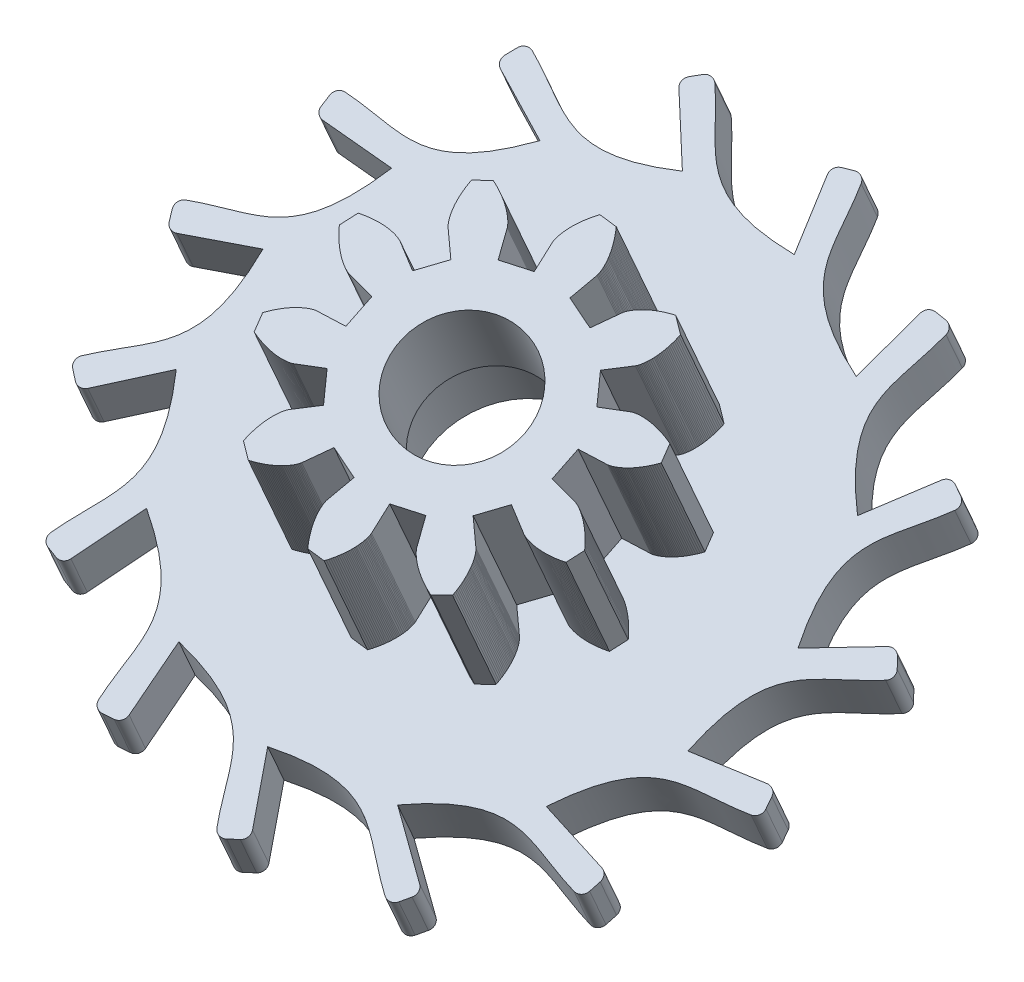
from build123d import *

# Parameters (mm, degrees)
BOSS_EXTRU_1_DEPTH                                = 3
BOSS_EXTRU_2_DEPTH                                = 8
CHAMBRAGE_POUR_VIS_T_TE_COURTE_BOMB_E_D           = 6
CHAMBRAGE_POUR_VIS_T_TE_COURTE_BOMB_E_DEPTH       = 23.010610864
CHAMBRAGE_POUR_VIS_T_TE_COURTE_BOMB_E_CBORE_D     = 8.2
CHAMBRAGE_POUR_VIS_T_TE_COURTE_BOMB_E_CBORE_DEPTH = 6
CHANFREIN1_SIZE                                   = 0.5
CONG_1_R                                          = 0.4


with BuildPart() as part:
    # Esquisse1 → Boss.-Extru.1 (new body)
    with BuildSketch(Plane(origin=(6.407585618, 24.446842904, 14.355449102), x_dir=(-0.9673252584845773, 0.2535386445845004, 0), z_dir=(0.22045579862678263, 0.8411043718426235, 0.49390553400326775))):
        with BuildLine():
            Line((11.803950496, -29.629611173), (11.728763686, -30.913090095))
            Line((11.728763686, -30.913090095), (15.322288109, -31.288362296))
            add(Edge.make_bspline(
                [(15.322288109, -31.288362296), (13.693575324, -35.735251177), (11.898416098, -34.95334924), (9.092736439, -36.069585831)],
                knots=[0, 0, 0, 0, 1, 1, 1, 1], degree=3))
            Line((9.092736439, -36.069585831), (9.546087778, -37.272683401))
            Line((9.546087778, -37.272683401), (12.981572647, -36.153893555))
            add(Edge.make_bspline(
                [(12.981572647, -36.153893555), (13.302382135, -40.878785864), (11.34439441, -40.894639938), (9.235292826, -43.055545531)],
                knots=[0, 0, 0, 0, 1, 1, 1, 1], degree=3))
            Line((9.235292826, -43.055545531), (10.138793749, -43.970235249))
            Line((10.138793749, -43.970235249), (12.822212519, -41.550832285))
            add(Edge.make_bspline(
                [(12.822212519, -41.550832285), (15.037073407, -45.736751217), (13.254811047, -46.547619989), (12.206970362, -49.379554377)],
                knots=[0, 0, 0, 0, 1, 1, 1, 1], degree=3))
            Line((12.206970362, -49.379554377), (13.404397352, -49.847678081))
            Line((13.404397352, -49.847678081), (14.871762541, -46.54599875))
            add(Edge.make_bspline(
                [(14.871762541, -46.54599875), (18.597705259, -49.469160894), (17.299337618, -50.934837787), (17.493939006, -53.948133786)],
                knots=[0, 0, 0, 0, 1, 1, 1, 1], degree=3))
            Line((17.493939006, -53.948133786), (18.778246057, -53.888748635))
            Line((18.778246057, -53.888748635), (18.775836893, -50.275683289))
            add(Edge.make_bspline(
                [(18.775836893, -50.275683289), (23.368612096, -51.430647354), (22.778638734, -53.297703518), (24.182033848, -55.971334874)],
                knots=[0, 0, 0, 0, 1, 1, 1, 1], degree=3))
            Line((24.182033848, -55.971334874), (25.331152604, -55.394709101))
            Line((25.331152604, -55.394709101), (23.859385652, -52.094989561))
            add(Edge.make_bspline(
                [(23.859385652, -52.094989561), (28.524860784, -51.282051768), (28.745293456, -53.22765623), (31.11482253, -55.099327794)],
                knots=[0, 0, 0, 0, 1, 1, 1, 1], degree=3))
            Line((31.11482253, -55.099327794), (31.930059919, -54.105165233))
            Line((31.930059919, -54.105165233), (29.243417056, -51.689342985))
            add(Edge.make_bspline(
                [(29.243417056, -51.689342985), (33.174889081, -49.049067664), (34.167612976, -50.736807738), (37.093562907, -51.482890492)],
                knots=[0, 0, 0, 0, 1, 1, 1, 1], degree=3))
            Line((37.093562907, -51.482890492), (37.433956978, -50.243090881))
            Line((37.433956978, -50.243090881), (33.996983163, -49.128883539))
            add(Edge.make_bspline(
                [(33.996983163, -49.128883539), (36.514664852, -45.117798278), (38.108028988, -46.255848372), (41.084476452, -45.74733783)],
                knots=[0, 0, 0, 0, 1, 1, 1, 1], degree=3))
            Line((41.084476452, -45.74733783), (40.891169978, -44.476273786))
            Line((40.891169978, -44.476273786), (37.298149207, -44.856337922))
            add(Edge.make_bspline(
                [(37.298149207, -44.856337922), (37.966710524, -40.167995803), (39.885207768, -40.559576717), (42.397497958, -38.884398971)],
                knots=[0, 0, 0, 0, 1, 1, 1, 1], degree=3))
            Line((42.397497958, -38.884398971), (41.703915383, -37.801849014))
            Line((41.703915383, -37.801849014), (38.57611359, -39.610468085))
            add(Edge.make_bspline(
                [(38.57611359, -39.610468085), (37.279954209, -35.055526053), (39.191858958, -34.632929889), (40.805594077, -32.080738391)],
                knots=[0, 0, 0, 0, 1, 1, 1, 1], degree=3))
            Line((40.805594077, -32.080738391), (39.731662131, -31.373885243))
            Line((39.731662131, -31.373885243), (37.609904659, -34.298332582))
            add(Edge.make_bspline(
                [(37.609904659, -34.298332582), (34.573142313, -30.664381493), (36.147868867, -29.500678968), (36.584019452, -26.512770813)],
                knots=[0, 0, 0, 0, 1, 1, 1, 1], degree=3))
            Line((36.584019452, -26.512770813), (35.315430724, -26.303835805))
            Line((35.315430724, -26.303835805), (34.566588718, -29.838447899))
            add(Edge.make_bspline(
                [(34.566588718, -29.838447899), (30.314307204, -27.753830912), (31.279571035, -26.050236763), (30.462722688, -23.143248416)],
                knots=[0, 0, 0, 0, 1, 1, 1, 1], degree=3))
            Line((30.462722688, -23.143248416), (29.218827694, -23.468358308))
            Line((29.218827694, -23.468358308), (29.972382739, -27.001968615))
            add(Edge.make_bspline(
                [(29.972382739, -27.001968615), (25.239840161, -26.827134944), (25.428738385, -24.878216078), (23.500131606, -22.554792232)],
                knots=[0, 0, 0, 0, 1, 1, 1, 1], degree=3))
            Line((23.500131606, -22.554792232), (22.496011091, -23.357732572))
            Line((22.496011091, -23.357732572), (24.621666673, -26.279347767))
            add(Edge.make_bspline(
                [(24.621666673, -26.279347767), (20.227162638, -28.044527742), (19.607033035, -26.187269935), (16.900141457, -24.849151682)],
                knots=[0, 0, 0, 0, 1, 1, 1, 1], degree=3))
            Line((16.900141457, -24.849151682), (16.30941698, -25.99108679))
            Line((16.30941698, -25.99108679), (19.439627938, -27.795533065))
            add(Edge.make_bspline(
                [(19.439627938, -27.795533065), (16.143012116, -31.195511032), (14.821080728, -29.751051032), (11.803950496, -29.629611173)],
                knots=[0, 0, 0, 0, 1, 1, 1, 1], degree=3))
        make_face()
    extrude(amount=-BOSS_EXTRU_1_DEPTH)

    # Esquisse2 → Boss.-Extru.2 (add)
    with BuildSketch(Plane(origin=(6.407585618, 24.446842904, 14.355449102), x_dir=(-0.9753969657794858, 0.19010345790327643, 0.11163079521973293), z_dir=(0.2204557986267831, 0.8411043718426222, 0.49390553400326986))):
        with BuildLine():
            Line((25.270754298, -43.143163892), (26.515512888, -43.38453265))
            Line((26.515512888, -43.38453265), (26.567222661, -43.399334931))
            Line((26.567222661, -43.399334931), (26.61574384, -43.417050188))
            Line((26.61574384, -43.417050188), (26.667564853, -43.438800124))
            Line((26.667564853, -43.438800124), (26.716116779, -43.461437811))
            Line((26.716116779, -43.461437811), (26.770669603, -43.489227805))
            Line((26.770669603, -43.489227805), (26.815337874, -43.513717716))
            Line((26.815337874, -43.513717716), (26.863069243, -43.541535517))
            Line((26.863069243, -43.541535517), (26.913717572, -43.572856712))
            Line((26.913717572, -43.572856712), (26.967130705, -43.60785197))
            Line((26.967130705, -43.60785197), (27.023146535, -43.646685635))
            Line((27.023146535, -43.646685635), (27.081599033, -43.689516253))
            Line((27.081599033, -43.689516253), (27.142315555, -43.73649534))
            Line((27.142315555, -43.73649534), (27.183963754, -43.770193688))
            Line((27.183963754, -43.770193688), (27.226483313, -43.80584165))
            Line((27.226483313, -43.80584165), (27.269817307, -43.843480935))
            Line((27.269817307, -43.843480935), (27.313912265, -43.883151532))
            Line((27.313912265, -43.883151532), (27.358706456, -43.924889001))
            Line((27.358706456, -43.924889001), (27.404143227, -43.968730273))
            Line((27.404143227, -43.968730273), (27.450160749, -44.014710542))
            Line((27.450160749, -44.014710542), (27.49669962, -44.062862385))
            Line((27.49669962, -44.062862385), (27.543696586, -44.11321864))
            Line((27.543696586, -44.11321864), (27.591087007, -44.165807028))
            Line((27.591087007, -44.165807028), (27.638808794, -44.220658894))
            Line((27.638808794, -44.220658894), (27.68679774, -44.277800667))
            Line((27.68679774, -44.277800667), (27.734985294, -44.337257209))
            Line((27.734985294, -44.337257209), (27.783306653, -44.399052756))
            Line((27.783306653, -44.399052756), (27.831694962, -44.463209748))
            Line((27.831694962, -44.463209748), (27.880082238, -44.529749366))
            Line((27.880082238, -44.529749366), (27.928397947, -44.598689163))
            Line((27.928397947, -44.598689163), (27.976796649, -44.670388016))
            Line((27.976796649, -44.670388016), (27.6973601, -45.404869881))
            Line((27.6973601, -45.404869881), (27.613542912, -45.426265899))
            Line((27.613542912, -45.426265899), (27.531621211, -45.445656607))
            Line((27.531621211, -45.445656607), (27.451242646, -45.463206169))
            Line((27.451242646, -45.463206169), (27.372445969, -45.478975057))
            Line((27.372445969, -45.478975057), (27.295269197, -45.493023944))
            Line((27.295269197, -45.493023944), (27.219746697, -45.505414492))
            Line((27.219746697, -45.505414492), (27.145911806, -45.516207465))
            Line((27.145911806, -45.516207465), (27.073798025, -45.525467113))
            Line((27.073798025, -45.525467113), (27.003435336, -45.533256287))
            Line((27.003435336, -45.533256287), (26.934852458, -45.539638964))
            Line((26.934852458, -45.539638964), (26.868076748, -45.544679884))
            Line((26.868076748, -45.544679884), (26.803133737, -45.54844428))
            Line((26.803133737, -45.54844428), (26.740045272, -45.550996817))
            Line((26.740045272, -45.550996817), (26.678836184, -45.552404487))
            Line((26.678836184, -45.552404487), (26.619524302, -45.552733045))
            Line((26.619524302, -45.552733045), (26.562128945, -45.552049408))
            Line((26.562128945, -45.552049408), (26.506667411, -45.55042026))
            Line((26.506667411, -45.55042026), (26.453152976, -45.547913372))
            Line((26.453152976, -45.547913372), (26.376563223, -45.542653749))
            Line((26.376563223, -45.542653749), (26.304422566, -45.535799173))
            Line((26.304422566, -45.535799173), (26.236759679, -45.527578336))
            Line((26.236759679, -45.527578336), (26.173593609, -45.518220584))
            Line((26.173593609, -45.518220584), (26.11493431, -45.507954982))
            Line((26.11493431, -45.507954982), (26.060783299, -45.497011314))
            Line((26.060783299, -45.497011314), (26.011132873, -45.485617157))
            Line((26.011132873, -45.485617157), (25.951903535, -45.470117899))
            Line((25.951903535, -45.470117899), (25.90058225, -45.454758364))
            Line((25.90058225, -45.454758364), (25.847409281, -45.436562867))
            Line((25.847409281, -45.436562867), (25.799384196, -45.417546079))
            Line((25.799384196, -45.417546079), (25.750911574, -45.394233398))
            Line((25.750911574, -45.394233398), (24.660499927, -44.74717232))
            Line((24.660499927, -44.74717232), (23.769902523, -45.853682162))
            Line((23.769902523, -45.853682162), (24.63506041, -46.780604288))
            Line((24.63506041, -46.780604288), (24.668193817, -46.822973663))
            Line((24.668193817, -46.822973663), (24.697035608, -46.865825881))
            Line((24.697035608, -46.865825881), (24.72617524, -46.913881245))
            Line((24.72617524, -46.913881245), (24.752148496, -46.960733576))
            Line((24.752148496, -46.960733576), (24.779948356, -47.015281594))
            Line((24.779948356, -47.015281594), (24.801690761, -47.061349709))
            Line((24.801690761, -47.061349709), (24.823955015, -47.111910431))
            Line((24.823955015, -47.111910431), (24.846520417, -47.167020463))
            Line((24.846520417, -47.167020463), (24.86916269, -47.226727674))
            Line((24.86916269, -47.226727674), (24.891654886, -47.29107007))
            Line((24.891654886, -47.29107007), (24.913768988, -47.360078101))
            Line((24.913768988, -47.360078101), (24.935275796, -47.433773522))
            Line((24.935275796, -47.433773522), (24.949162631, -47.48551589))
            Line((24.949162631, -47.48551589), (24.962607893, -47.539348176))
            Line((24.962607893, -47.539348176), (24.975542451, -47.59527069))
            Line((24.975542451, -47.59527069), (24.98789827, -47.653283449))
            Line((24.98789827, -47.653283449), (24.999605054, -47.713378847))
            Line((24.999605054, -47.713378847), (25.010594438, -47.775554243))
            Line((25.010594438, -47.775554243), (25.020797207, -47.839800953))
            Line((25.020797207, -47.839800953), (25.030145103, -47.906112387))
            Line((25.030145103, -47.906112387), (25.038567888, -47.974474649))
            Line((25.038567888, -47.974474649), (25.045996267, -48.044875153))
            Line((25.045996267, -48.044875153), (25.052363153, -48.117301502))
            Line((25.052363153, -48.117301502), (25.057599725, -48.191737063))
            Line((25.057599725, -48.191737063), (25.061636729, -48.268162181))
            Line((25.061636729, -48.268162181), (25.064407536, -48.346559627))
            Line((25.064407536, -48.346559627), (25.065843715, -48.426904821))
            Line((25.065843715, -48.426904821), (25.065878208, -48.509177511))
            Line((25.065878208, -48.509177511), (25.06444233, -48.593352475))
            Line((25.06444233, -48.593352475), (25.06145441, -48.679806217))
            Line((25.06145441, -48.679806217), (24.403662126, -49.109768753))
            Line((24.403662126, -49.109768753), (24.323276433, -49.077812512))
            Line((24.323276433, -49.077812512), (24.245602608, -49.045346859))
            Line((24.245602608, -49.045346859), (24.170259288, -49.012299511))
            Line((24.170259288, -49.012299511), (24.097242734, -48.978741285))
            Line((24.097242734, -48.978741285), (24.026547562, -48.944743444))
            Line((24.026547562, -48.944743444), (23.958165984, -48.910376335))
            Line((23.958165984, -48.910376335), (23.89208817, -48.87570929))
            Line((23.89208817, -48.87570929), (23.828304505, -48.840813151))
            Line((23.828304505, -48.840813151), (23.76680166, -48.80575663))
            Line((23.76680166, -48.80575663), (23.707565299, -48.770608712))
            Line((23.707565299, -48.770608712), (23.650579398, -48.735436486))
            Line((23.650579398, -48.735436486), (23.595826973, -48.700309654))
            Line((23.595826973, -48.700309654), (23.543286975, -48.665291964))
            Line((23.543286975, -48.665291964), (23.492940215, -48.630452932))
            Line((23.492940215, -48.630452932), (23.444762978, -48.595856241))
            Line((23.444762978, -48.595856241), (23.39873102, -48.561566506))
            Line((23.39873102, -48.561566506), (23.354819289, -48.527649341))
            Line((23.354819289, -48.527649341), (23.31299888, -48.494165918))
            Line((23.31299888, -48.494165918), (23.254127689, -48.444892373))
            Line((23.254127689, -48.444892373), (23.199793975, -48.396943826))
            Line((23.199793975, -48.396943826), (23.14988558, -48.350521664))
            Line((23.14988558, -48.350521664), (23.104283737, -48.305822798))
            Line((23.104283737, -48.305822798), (23.062861032, -48.263038635))
            Line((23.062861032, -48.263038635), (23.02548472, -48.222355755))
            Line((23.02548472, -48.222355755), (22.992013853, -48.183954335))
            Line((22.992013853, -48.183954335), (22.953206568, -48.136600651))
            Line((22.953206568, -48.136600651), (22.920715138, -48.094008977))
            Line((22.920715138, -48.094008977), (22.8883925, -48.04803351))
            Line((22.8883925, -48.04803351), (22.860716754, -48.004420427))
            Line((22.860716754, -48.004420427), (22.835204717, -47.957068925))
            Line((22.835204717, -47.957068925), (22.333376717, -46.792656715))
            Line((22.333376717, -46.792656715), (20.962483196, -47.164359468))
            Line((20.962483196, -47.164359468), (21.117579309, -48.422782678))
            Line((21.117579309, -48.422782678), (21.119480726, -48.476535942))
            Line((21.119480726, -48.476535942), (21.117622786, -48.528157052))
            Line((21.117622786, -48.528157052), (21.112951006, -48.584162361))
            Line((21.112951006, -48.584162361), (21.106424548, -48.637333303))
            Line((21.106424548, -48.637333303), (21.096852767, -48.697804434))
            Line((21.096852767, -48.697804434), (21.08736462, -48.747853714))
            Line((21.08736462, -48.747853714), (21.075657937, -48.801844904))
            Line((21.075657937, -48.801844904), (21.061520605, -48.859693555))
            Line((21.061520605, -48.859693555), (21.044743845, -48.921307257))
            Line((21.044743845, -48.921307257), (21.02512056, -48.986581378))
            Line((21.02512056, -48.986581378), (21.002449487, -49.05540892))
            Line((21.002449487, -49.05540892), (20.976531684, -49.127670492))
            Line((20.976531684, -49.127670492), (20.957352944, -49.177693942))
            Line((20.957352944, -49.177693942), (20.936588692, -49.229148067))
            Line((20.936588692, -49.229148067), (20.914182578, -49.281992458))
            Line((20.914182578, -49.281992458), (20.890079657, -49.336187896))
            Line((20.890079657, -49.336187896), (20.864227215, -49.391687498))
            Line((20.864227215, -49.391687498), (20.836572162, -49.448448402))
            Line((20.836572162, -49.448448402), (20.807062851, -49.506421869))
            Line((20.807062851, -49.506421869), (20.775648717, -49.565562785))
            Line((20.775648717, -49.565562785), (20.742279999, -49.625820329))
            Line((20.742279999, -49.625820329), (20.706909464, -49.687141424))
            Line((20.706909464, -49.687141424), (20.669489149, -49.7494779))
            Line((20.669489149, -49.7494779), (20.629973555, -49.812776211))
            Line((20.629973555, -49.812776211), (20.588317838, -49.876978712))
            Line((20.588317838, -49.876978712), (20.544479238, -49.942031116))
            Line((20.544479238, -49.942031116), (20.498414569, -50.007876111))
            Line((20.498414569, -50.007876111), (20.450084147, -50.074457008))
            Line((20.450084147, -50.074457008), (20.399448362, -50.141711605))
            Line((20.399448362, -50.141711605), (20.34621504, -50.209898729))
            Line((20.34621504, -50.209898729), (19.561323971, -50.171103789))
            Line((19.561323971, -50.171103789), (19.515074478, -50.098001794))
            Line((19.515074478, -50.098001794), (19.471317452, -50.026080459))
            Line((19.471317452, -50.026080459), (19.429788604, -49.955059286))
            Line((19.429788604, -49.955059286), (19.390441996, -49.884992301))
            Line((19.390441996, -49.884992301), (19.353231686, -49.815933527))
            Line((19.353231686, -49.815933527), (19.318110061, -49.747935875))
            Line((19.318110061, -49.747935875), (19.285029093, -49.681050013))
            Line((19.285029093, -49.681050013), (19.253938384, -49.615327254))
            Line((19.253938384, -49.615327254), (19.224787469, -49.550815789))
            Line((19.224787469, -49.550815789), (19.197523831, -49.487562016))
            Line((19.197523831, -49.487562016), (19.172094755, -49.4256116))
            Line((19.172094755, -49.4256116), (19.148446245, -49.365010553))
            Line((19.148446245, -49.365010553), (19.126523452, -49.305798845))
            Line((19.126523452, -49.305798845), (19.106270145, -49.248020742))
            Line((19.106270145, -49.248020742), (19.087629403, -49.191713639))
            Line((19.087629403, -49.191713639), (19.070543592, -49.136915906))
            Line((19.070543592, -49.136915906), (19.054954414, -49.08366492))
            Line((19.054954414, -49.08366492), (19.040802033, -49.031994551))
            Line((19.040802033, -49.031994551), (19.022136285, -48.957528416))
            Line((19.022136285, -48.957528416), (19.006362898, -48.886800386))
            Line((19.006362898, -48.886800386), (18.993272741, -48.819909124))
            Line((18.993272741, -48.819909124), (18.982653067, -48.756942119))
            Line((18.982653067, -48.756942119), (18.974289276, -48.697981478))
            Line((18.974289276, -48.697981478), (18.967964178, -48.643099031))
            Line((18.967964178, -48.643099031), (18.963457842, -48.592357939))
            Line((18.963457842, -48.592357939), (18.959895743, -48.53123773))
            Line((18.959895743, -48.53123773), (18.958644265, -48.477681971))
            Line((18.958644265, -48.477681971), (18.959518428, -48.421488699))
            Line((18.959518428, -48.421488699), (18.96276362, -48.369937628))
            Line((18.96276362, -48.369937628), (18.969956506, -48.316633835))
            Line((18.969956506, -48.316633835), (19.24839368, -47.079637432))
            Line((19.24839368, -47.079637432), (17.920834681, -46.574559199))
            Line((17.920834681, -46.574559199), (17.306627007, -47.683807785))
            Line((17.306627007, -47.683807785), (17.276569981, -47.728412948))
            Line((17.276569981, -47.728412948), (17.244727796, -47.769085292))
            Line((17.244727796, -47.769085292), (17.208029294, -47.811648486))
            Line((17.208029294, -47.811648486), (17.171495834, -47.850828513))
            Line((17.171495834, -47.850828513), (17.128208019, -47.894123819))
            Line((17.128208019, -47.894123819), (17.091114051, -47.929038191))
            Line((17.091114051, -47.929038191), (17.049907794, -47.96583658))
            Line((17.049907794, -47.96583658), (17.004467935, -48.004327566))
            Line((17.004467935, -48.004327566), (16.95467981, -48.044312435))
            Line((16.95467981, -48.044312435), (16.900436998, -48.085586711))
            Line((16.900436998, -48.085586711), (16.841640086, -48.127942838))
            Line((16.841640086, -48.127942838), (16.778197864, -48.171170254))
            Line((16.778197864, -48.171170254), (16.733278686, -48.200366765))
            Line((16.733278686, -48.200366765), (16.686235974, -48.229788855))
            Line((16.686235974, -48.229788855), (16.637048047, -48.259371027))
            Line((16.637048047, -48.259371027), (16.585692794, -48.289049083))
            Line((16.585692794, -48.289049083), (16.532156075, -48.318753522))
            Line((16.532156075, -48.318753522), (16.476419598, -48.348418325))
            Line((16.476419598, -48.348418325), (16.418469621, -48.377975453))
            Line((16.418469621, -48.377975453), (16.358293398, -48.407356205))
            Line((16.358293398, -48.407356205), (16.295878749, -48.436492511))
            Line((16.295878749, -48.436492511), (16.231219838, -48.46531223))
            Line((16.231219838, -48.46531223), (16.164305609, -48.493748553))
            Line((16.164305609, -48.493748553), (16.095131089, -48.521731067))
            Line((16.095131089, -48.521731067), (16.023693729, -48.549186736))
            Line((16.023693729, -48.549186736), (15.949990808, -48.576047671))
            Line((15.949990808, -48.576047671), (15.87402054, -48.602242201))
            Line((15.87402054, -48.602242201), (15.795785356, -48.627698292))
            Line((15.795785356, -48.627698292), (15.71528901, -48.652345909))
            Line((15.71528901, -48.652345909), (15.632142993, -48.676220195))
            Line((15.632142993, -48.676220195), (15.01995521, -48.183488164))
            Line((15.01995521, -48.183488164), (15.025507065, -48.097161605))
            Line((15.025507065, -48.097161605), (15.032380909, -48.01325777))
            Line((15.032380909, -48.01325777), (15.040529049, -47.931389591))
            Line((15.040529049, -47.931389591), (15.049881445, -47.85157645))
            Line((15.049881445, -47.85157645), (15.060369756, -47.773835311))
            Line((15.060369756, -47.773835311), (15.071923386, -47.698180606))
            Line((15.071923386, -47.698180606), (15.084474996, -47.624624322))
            Line((15.084474996, -47.624624322), (15.097952667, -47.553178898))
            Line((15.097952667, -47.553178898), (15.112288068, -47.483852665))
            Line((15.112288068, -47.483852665), (15.127411409, -47.416654351))
            Line((15.127411409, -47.416654351), (15.14325191, -47.351589029))
            Line((15.14325191, -47.351589029), (15.159740617, -47.288661279))
            Line((15.159740617, -47.288661279), (15.176808413, -47.227872191))
            Line((15.176808413, -47.227872191), (15.194384358, -47.169223356))
            Line((15.194384358, -47.169223356), (15.212400567, -47.112713178))
            Line((15.212400567, -47.112713178), (15.230787104, -47.058338267))
            Line((15.230787104, -47.058338267), (15.249474927, -47.006094206))
            Line((15.249474927, -47.006094206), (15.268396228, -46.955973891))
            Line((15.268396228, -46.955973891), (15.297065499, -46.884758048))
            Line((15.297065499, -46.884758048), (15.325877694, -46.818266572))
            Line((15.325877694, -46.818266572), (15.354605253, -46.756455672))
            Line((15.354605253, -46.756455672), (15.383024532, -46.699272851))
            Line((15.383024532, -46.699272851), (15.410914604, -46.646656835))
            Line((15.410914604, -46.646656835), (15.438056165, -46.598537869))
            Line((15.438056165, -46.598537869), (15.464235681, -46.554838558))
            Line((15.464235681, -46.554838558), (15.497279232, -46.503297774))
            Line((15.497279232, -46.503297774), (15.527746337, -46.459234557))
            Line((15.527746337, -46.459234557), (15.561482689, -46.414287077))
            Line((15.561482689, -46.414287077), (15.59440925, -46.374488556))
            Line((15.59440925, -46.374488556), (15.63155983, -46.335592967))
            Line((15.63155983, -46.335592967), (16.583909466, -45.498503342))
            Line((16.583909466, -45.498503342), (15.806769089, -44.309567267))
            Line((15.806769089, -44.309567267), (14.657864948, -44.845946597))
            Line((14.657864948, -44.845946597), (14.607330234, -44.864365549))
            Line((14.607330234, -44.864365549), (14.557662853, -44.878553565))
            Line((14.557662853, -44.878553565), (14.502954812, -44.891417133))
            Line((14.502954812, -44.891417133), (14.450368699, -44.901641059))
            Line((14.450368699, -44.901641059), (14.389899847, -44.911224173))
            Line((14.389899847, -44.911224173), (14.339367655, -44.917666704))
            Line((14.339367655, -44.917666704), (14.284401447, -44.923217162))
            Line((14.284401447, -44.923217162), (14.225015634, -44.927648112))
            Line((14.225015634, -44.927648112), (14.161233916, -44.930731658))
            Line((14.161233916, -44.930731658), (14.093090207, -44.932239977))
            Line((14.093090207, -44.932239977), (14.020625987, -44.931947119))
            Line((14.020625987, -44.931947119), (13.943891665, -44.929628239))
            Line((13.943891665, -44.929628239), (13.890390081, -44.926846122))
            Line((13.890390081, -44.926846122), (13.835037983, -44.922998306))
            Line((13.835037983, -44.922998306), (13.777855867, -44.918018646))
            Line((13.777855867, -44.918018646), (13.718864724, -44.911842823))
            Line((13.718864724, -44.911842823), (13.658092494, -44.904406105))
            Line((13.658092494, -44.904406105), (13.595564168, -44.89564446))
            Line((13.595564168, -44.89564446), (13.531308837, -44.885494512))
            Line((13.531308837, -44.885494512), (13.465354996, -44.873893584))
            Line((13.465354996, -44.873893584), (13.397735029, -44.860778875))
            Line((13.397735029, -44.860778875), (13.3284848, -44.846088848))
            Line((13.3284848, -44.846088848), (13.257635777, -44.829763108))
            Line((13.257635777, -44.829763108), (13.185225011, -44.81174161))
            Line((13.185225011, -44.81174161), (13.111292652, -44.791964153))
            Line((13.111292652, -44.791964153), (13.035877285, -44.770373463))
            Line((13.035877285, -44.770373463), (12.959019556, -44.746911165))
            Line((12.959019556, -44.746911165), (12.880762881, -44.72152044))
            Line((12.880762881, -44.72152044), (12.801152645, -44.694145942))
            Line((12.801152645, -44.694145942), (12.719853349, -44.664588762))
            Line((12.719853349, -44.664588762), (12.51420388, -43.906125455))
            Line((12.51420388, -43.906125455), (12.569436959, -43.839549396))
            Line((12.569436959, -43.839549396), (12.624315505, -43.775709699))
            Line((12.624315505, -43.775709699), (12.679028038, -43.714266084))
            Line((12.679028038, -43.714266084), (12.733507308, -43.655193255))
            Line((12.733507308, -43.655193255), (12.787687118, -43.598464015))
            Line((12.787687118, -43.598464015), (12.841503101, -43.544049247))
            Line((12.841503101, -43.544049247), (12.894892837, -43.491918327))
            Line((12.894892837, -43.491918327), (12.947791343, -43.442039854))
            Line((12.947791343, -43.442039854), (13.000137745, -43.394380237))
            Line((13.000137745, -43.394380237), (13.051870774, -43.348904421))
            Line((13.051870774, -43.348904421), (13.102930536, -43.305576636))
            Line((13.102930536, -43.305576636), (13.15325804, -43.264358662))
            Line((13.15325804, -43.264358662), (13.20279717, -43.225211302))
            Line((13.20279717, -43.225211302), (13.251489218, -43.188094493))
            Line((13.251489218, -43.188094493), (13.299280422, -43.152966148))
            Line((13.299280422, -43.152966148), (13.346115987, -43.119783278))
            Line((13.346115987, -43.119783278), (13.391943141, -43.088501665))
            Line((13.391943141, -43.088501665), (13.43671093, -43.059075123))
            Line((13.43671093, -43.059075123), (13.501764738, -43.018311615))
            Line((13.501764738, -43.018311615), (13.564156841, -42.981454099))
            Line((13.564156841, -42.981454099), (13.623729304, -42.948333731))
            Line((13.623729304, -42.948333731), (13.680332164, -42.91877637))
            Line((13.680332164, -42.91877637), (13.733822531, -42.892602132))
            Line((13.733822531, -42.892602132), (13.784064202, -42.869626869))
            Line((13.784064202, -42.869626869), (13.830929702, -42.849661027))
            Line((13.830929702, -42.849661027), (13.887957318, -42.827386116))
            Line((13.887957318, -42.827386116), (13.938505956, -42.809646229))
            Line((13.938505956, -42.809646229), (13.992218947, -42.793112767))
            Line((13.992218947, -42.793112767), (14.042249967, -42.780268796))
            Line((14.042249967, -42.780268796), (14.095167866, -42.770637947))
            Line((14.095167866, -42.770637947), (15.357662884, -42.653193083))
            Line((15.357662884, -42.653193083), (15.427782629, -41.234532078))
            Line((15.427782629, -41.234532078), (14.183024033, -40.99316332))
            Line((14.183024033, -40.99316332), (14.13131427, -40.978361004))
            Line((14.13131427, -40.978361004), (14.082792954, -40.960645166))
            Line((14.082792954, -40.960645166), (14.030972104, -40.938895743))
            Line((14.030972104, -40.938895743), (13.982420193, -40.916258024))
            Line((13.982420193, -40.916258024), (13.927867387, -40.888467994))
            Line((13.927867387, -40.888467994), (13.883198866, -40.863978518))
            Line((13.883198866, -40.863978518), (13.835467782, -40.836160221))
            Line((13.835467782, -40.836160221), (13.784819109, -40.80483909))
            Line((13.784819109, -40.80483909), (13.731406365, -40.769843698))
            Line((13.731406365, -40.769843698), (13.675390195, -40.731010095))
            Line((13.675390195, -40.731010095), (13.616937361, -40.688179537))
            Line((13.616937361, -40.688179537), (13.556221699, -40.641200576))
            Line((13.556221699, -40.641200576), (13.514572694, -40.607502033))
            Line((13.514572694, -40.607502033), (13.472053988, -40.57185421))
            Line((13.472053988, -40.57185421), (13.428719189, -40.534214729))
            Line((13.428719189, -40.534214729), (13.384624623, -40.494544003))
            Line((13.384624623, -40.494544003), (13.339830194, -40.452806968))
            Line((13.339830194, -40.452806968), (13.294393718, -40.408965202))
            Line((13.294393718, -40.408965202), (13.248375694, -40.362985831))
            Line((13.248375694, -40.362985831), (13.201837487, -40.314833394))
            Line((13.201837487, -40.314833394), (13.154839824, -40.264477306))
            Line((13.154839824, -40.264477306), (13.107450169, -40.211888688))
            Line((13.107450169, -40.211888688), (13.059727688, -40.157036988))
            Line((13.059727688, -40.157036988), (13.011738779, -40.099895183))
            Line((13.011738779, -40.099895183), (12.963551266, -40.040438609))
            Line((12.963551266, -40.040438609), (12.915230047, -39.978643395))
            Line((12.915230047, -39.978643395), (12.866841681, -39.914486005))
            Line((12.866841681, -39.914486005), (12.81845518, -39.847946157))
            Line((12.81845518, -39.847946157), (12.770139518, -39.779006328))
            Line((12.770139518, -39.779006328), (12.721740133, -39.707307641))
            Line((12.721740133, -39.707307641), (13.001179772, -38.972820208))
            Line((13.001179772, -38.972820208), (13.084996527, -38.951424048))
            Line((13.084996527, -38.951424048), (13.166918623, -38.932033363))
            Line((13.166918623, -38.932033363), (13.247297578, -38.914483822))
            Line((13.247297578, -38.914483822), (13.326094279, -38.898715051))
            Line((13.326094279, -38.898715051), (13.403271339, -38.884665814))
            Line((13.403271339, -38.884665814), (13.478793591, -38.872275843))
            Line((13.478793591, -38.872275843), (13.552628764, -38.861482515))
            Line((13.552628764, -38.861482515), (13.624742558, -38.852222974))
            Line((13.624742558, -38.852222974), (13.695104993, -38.84443437))
            Line((13.695104993, -38.84443437), (13.763688147, -38.83805133))
            Line((13.763688147, -38.83805133), (13.830463499, -38.833010609))
            Line((13.830463499, -38.833010609), (13.895406515, -38.829246309))
            Line((13.895406515, -38.829246309), (13.958494984, -38.826693866))
            Line((13.958494984, -38.826693866), (14.019704805, -38.825286088))
            Line((14.019704805, -38.825286088), (14.079016323, -38.824957718))
            Line((14.079016323, -38.824957718), (14.136411313, -38.825641539))
            Line((14.136411313, -38.825641539), (14.19187321, -38.827270671))
            Line((14.19187321, -38.827270671), (14.24538774, -38.829778004))
            Line((14.24538774, -38.829778004), (14.321977287, -38.835037009))
            Line((14.321977287, -38.835037009), (14.394118033, -38.841892058))
            Line((14.394118033, -38.841892058), (14.461780908, -38.850112996))
            Line((14.461780908, -38.850112996), (14.524946964, -38.859470841))
            Line((14.524946964, -38.859470841), (14.583606149, -38.869736165))
            Line((14.583606149, -38.869736165), (14.637757143, -38.880679914))
            Line((14.637757143, -38.880679914), (14.687407918, -38.892074046))
            Line((14.687407918, -38.892074046), (14.746637233, -38.907573392))
            Line((14.746637233, -38.907573392), (14.797958228, -38.922933468))
            Line((14.797958228, -38.922933468), (14.85113117, -38.941129044))
            Line((14.85113117, -38.941129044), (14.899156493, -38.960145439))
            Line((14.899156493, -38.960145439), (14.947628715, -38.983458291))
            Line((14.947628715, -38.983458291), (16.038041029, -39.630519764))
            Line((16.038041029, -39.630519764), (16.928637198, -38.524014028))
            Line((16.928637198, -38.524014028), (16.063479359, -37.597091953))
            Line((16.063479359, -37.597091953), (16.030345975, -37.55472256))
            Line((16.030345975, -37.55472256), (16.001504107, -37.511869961))
            Line((16.001504107, -37.511869961), (15.972364601, -37.463814947))
            Line((15.972364601, -37.463814947), (15.946391369, -37.416962602))
            Line((15.946391369, -37.416962602), (15.918591539, -37.36241457))
            Line((15.918591539, -37.36241457), (15.896848976, -37.316346492))
            Line((15.896848976, -37.316346492), (15.874584565, -37.265785808))
            Line((15.874584565, -37.265785808), (15.852019277, -37.210675349))
            Line((15.852019277, -37.210675349), (15.829377135, -37.150968491))
            Line((15.829377135, -37.150968491), (15.806885156, -37.086626034))
            Line((15.806885156, -37.086626034), (15.784770908, -37.01761804))
            Line((15.784770908, -37.01761804), (15.763264338, -36.943923339))
            Line((15.763264338, -36.943923339), (15.749377233, -36.892179866))
            Line((15.749377233, -36.892179866), (15.735931917, -36.838347989))
            Line((15.735931917, -36.838347989), (15.722997769, -36.782426149))
            Line((15.722997769, -36.782426149), (15.710641981, -36.724413383))
            Line((15.710641981, -36.724413383), (15.698935047, -36.664318028))
            Line((15.698935047, -36.664318028), (15.687945498, -36.602141896))
            Line((15.687945498, -36.602141896), (15.677742763, -36.53789518))
            Line((15.677742763, -36.53789518), (15.668395299, -36.471585202))
            Line((15.668395299, -36.471585202), (15.659972536, -36.403222156))
            Line((15.659972536, -36.403222156), (15.652544012, -36.332821698))
            Line((15.652544012, -36.332821698), (15.646176966, -36.260394614))
            Line((15.646176966, -36.260394614), (15.640940252, -36.1859591))
            Line((15.640940252, -36.1859591), (15.636903471, -36.109533931))
            Line((15.636903471, -36.109533931), (15.634132919, -36.031137993))
            Line((15.634132919, -36.031137993), (15.632696387, -35.950791338))
            Line((15.632696387, -35.950791338), (15.632661755, -35.868518697))
            Line((15.632661755, -35.868518697), (15.634095827, -35.78434588))
            Line((15.634095827, -35.78434588), (15.637083415, -35.697891458))
            Line((15.637083415, -35.697891458), (16.294875944, -35.267929297))
            Line((16.294875944, -35.267929297), (16.375261452, -35.299886413))
            Line((16.375261452, -35.299886413), (16.45293506, -35.33235138))
            Line((16.45293506, -35.33235138), (16.528278361, -35.365398771))
            Line((16.528278361, -35.365398771), (16.601294896, -35.398957039))
            Line((16.601294896, -35.398957039), (16.671990414, -35.432954821))
            Line((16.671990414, -35.432954821), (16.74037179, -35.467322018))
            Line((16.74037179, -35.467322018), (16.806449782, -35.501989831))
            Line((16.806449782, -35.501989831), (16.870233427, -35.536886007))
            Line((16.870233427, -35.536886007), (16.931736526, -35.571942489))
            Line((16.931736526, -35.571942489), (16.990972867, -35.607090441))
            Line((16.990972867, -35.607090441), (17.047958368, -35.642262019))
            Line((17.047958368, -35.642262019), (17.102710955, -35.677388832))
            Line((17.102710955, -35.677388832), (17.155250841, -35.712406577))
            Line((17.155250841, -35.712406577), (17.205597673, -35.747245613))
            Line((17.205597673, -35.747245613), (17.25377489, -35.781842331))
            Line((17.25377489, -35.781842331), (17.29980663, -35.816131362))
            Line((17.29980663, -35.816131362), (17.34371854, -35.850049282))
            Line((17.34371854, -35.850049282), (17.385539128, -35.88353346))
            Line((17.385539128, -35.88353346), (17.444409896, -35.932805577))
            Line((17.444409896, -35.932805577), (17.498743963, -35.980754837))
            Line((17.498743963, -35.980754837), (17.54865224, -36.027177051))
            Line((17.54865224, -36.027177051), (17.594253951, -36.071875188))
            Line((17.594253951, -36.071875188), (17.635676632, -36.114659375))
            Line((17.635676632, -36.114659375), (17.673053118, -36.155343007))
            Line((17.673053118, -36.155343007), (17.706523781, -36.193744495))
            Line((17.706523781, -36.193744495), (17.745331023, -36.241097421))
            Line((17.745331023, -36.241097421), (17.777822627, -36.283689844))
            Line((17.777822627, -36.283689844), (17.810145041, -36.329664599))
            Line((17.810145041, -36.329664599), (17.837820861, -36.373278063))
            Line((17.837820861, -36.373278063), (17.863332871, -36.420629579))
            Line((17.863332871, -36.420629579), (18.365160458, -37.585040831))
            Line((18.365160458, -37.585040831), (19.736055778, -37.213338184))
            Line((19.736055778, -37.213338184), (19.580959718, -35.954915412))
            Line((19.580959718, -35.954915412), (19.579058418, -35.901162513))
            Line((19.579058418, -35.901162513), (19.580912687, -35.849541126))
            Line((19.580912687, -35.849541126), (19.585584665, -35.793536547))
            Line((19.585584665, -35.793536547), (19.592110925, -35.740364874))
            Line((19.592110925, -35.740364874), (19.601682904, -35.679894474))
            Line((19.601682904, -35.679894474), (19.611170853, -35.629844463))
            Line((19.611170853, -35.629844463), (19.622877734, -35.575854004))
            Line((19.622877734, -35.575854004), (19.637014594, -35.518004697))
            Line((19.637014594, -35.518004697), (19.653791751, -35.456392456))
            Line((19.653791751, -35.456392456), (19.673414837, -35.391117604))
            Line((19.673414837, -35.391117604), (19.6960862, -35.322290768))
            Line((19.6960862, -35.322290768), (19.722003911, -35.250029221))
            Line((19.722003911, -35.250029221), (19.741182453, -35.20000504))
            Line((19.741182453, -35.20000504), (19.761946614, -35.14855094))
            Line((19.761946614, -35.14855094), (19.78435291, -35.095706499))
            Line((19.78435291, -35.095706499), (19.808455832, -35.041511061))
            Line((19.808455832, -35.041511061), (19.83430809, -34.98601151))
            Line((19.83430809, -34.98601151), (19.861963235, -34.92925058))
            Line((19.861963235, -34.92925058), (19.891472363, -34.871277163))
            Line((19.891472363, -34.871277163), (19.922886498, -34.812136247))
            Line((19.922886498, -34.812136247), (19.956255033, -34.751878753))
            Line((19.956255033, -34.751878753), (19.991625659, -34.690557633))
            Line((19.991625659, -34.690557633), (20.029045776, -34.628220426))
            Line((20.029045776, -34.628220426), (20.068561568, -34.564922846))
            Line((20.068561568, -34.564922846), (20.110217103, -34.500720394))
            Line((20.110217103, -34.500720394), (20.154055703, -34.435667991))
            Line((20.154055703, -34.435667991), (20.200120173, -34.369822265))
            Line((20.200120173, -34.369822265), (20.248450976, -34.303242049))
            Line((20.248450976, -34.303242049), (20.299086578, -34.235987502))
            Line((20.299086578, -34.235987502), (20.352319901, -34.167800378))
            Line((20.352319901, -34.167800378), (21.137210588, -34.206594637))
            Line((21.137210588, -34.206594637), (21.18346028, -34.279697362))
            Line((21.18346028, -34.279697362), (21.22721729, -34.351617917))
            Line((21.22721729, -34.351617917), (21.268746138, -34.422639089))
            Line((21.268746138, -34.422639089), (21.308092945, -34.492706805))
            Line((21.308092945, -34.492706805), (21.345303057, -34.561764849))
            Line((21.345303057, -34.561764849), (21.380424682, -34.629762501))
            Line((21.380424682, -34.629762501), (21.41350603, -34.696649044))
            Line((21.41350603, -34.696649044), (21.44459674, -34.762371803))
            Line((21.44459674, -34.762371803), (21.473747472, -34.826883317))
            Line((21.473747472, -34.826883317), (21.501011109, -34.89013709))
            Line((21.501011109, -34.89013709), (21.52644017, -34.952086726))
            Line((21.52644017, -34.952086726), (21.550088498, -35.012687823))
            Line((21.550088498, -35.012687823), (21.572011854, -35.071900162))
            Line((21.572011854, -35.071900162), (21.592265161, -35.129678265))
            Line((21.592265161, -35.129678265), (21.61090572, -35.185985418))
            Line((21.61090572, -35.185985418), (21.627991532, -35.240783151))
            Line((21.627991532, -35.240783151), (21.643580793, -35.294033722))
            Line((21.643580793, -35.294033722), (21.657733174, -35.345704091))
            Line((21.657733174, -35.345704091), (21.67639864, -35.42016991))
            Line((21.67639864, -35.42016991), (21.692172027, -35.49089794))
            Line((21.692172027, -35.49089794), (21.705262466, -35.557789518))
            Line((21.705262466, -35.557789518), (21.715881942, -35.620755792))
            Line((21.715881942, -35.620755792), (21.724245733, -35.679716433))
            Line((21.724245733, -35.679716433), (21.730571013, -35.734598831))
            Line((21.730571013, -35.734598831), (21.735077449, -35.785340289))
            Line((21.735077449, -35.785340289), (21.738639449, -35.846460132))
            Line((21.738639449, -35.846460132), (21.739890927, -35.900015891))
            Line((21.739890927, -35.900015891), (21.739017284, -35.956209618))
            Line((21.739017284, -35.956209618), (21.735772255, -36.007760638))
            Line((21.735772255, -36.007760638), (21.728578984, -36.061064527))
            Line((21.728578984, -36.061064527), (21.450141961, -37.298060259))
            Line((21.450141961, -37.298060259), (22.777702221, -37.803139243))
            Line((22.777702221, -37.803139243), (23.391910026, -36.69389042))
            Line((23.391910026, -36.69389042), (23.421966795, -36.649285727))
            Line((23.421966795, -36.649285727), (23.453808989, -36.60861339))
            Line((23.453808989, -36.60861339), (23.490507865, -36.566050104))
            Line((23.490507865, -36.566050104), (23.527041333, -36.526870085))
            Line((23.527041333, -36.526870085), (23.570328593, -36.483574157))
            Line((23.570328593, -36.483574157), (23.607423132, -36.448660424))
            Line((23.607423132, -36.448660424), (23.648629198, -36.411861313))
            Line((23.648629198, -36.411861313), (23.694069165, -36.373370702))
            Line((23.694069165, -36.373370702), (23.743857032, -36.333386307))
            Line((23.743857032, -36.333386307), (23.798099852, -36.292112043))
            Line((23.798099852, -36.292112043), (23.856897139, -36.249755829))
            Line((23.856897139, -36.249755829), (23.920339369, -36.206528426))
            Line((23.920339369, -36.206528426), (23.965258089, -36.177331657))
            Line((23.965258089, -36.177331657), (24.012300442, -36.147909677))
            Line((24.012300442, -36.147909677), (24.061489105, -36.118327317))
            Line((24.061489105, -36.118327317), (24.112844099, -36.088649736))
            Line((24.112844099, -36.088649736), (24.166380725, -36.058944942))
            Line((24.166380725, -36.058944942), (24.222117307, -36.029280517))
            Line((24.222117307, -36.029280517), (24.280066925, -35.9997235))
            Line((24.280066925, -35.9997235), (24.340243686, -35.970341832))
            Line((24.340243686, -35.970341832), (24.402658075, -35.941206003))
            Line((24.402658075, -35.941206003), (24.467316992, -35.912386298))
            Line((24.467316992, -35.912386298), (24.534231227, -35.883949988))
            Line((24.534231227, -35.883949988), (24.603405388, -35.855967588))
            Line((24.603405388, -35.855967588), (24.674843119, -35.828511834))
            Line((24.674843119, -35.828511834), (24.748546045, -35.801650914))
            Line((24.748546045, -35.801650914), (24.824516319, -35.775456401))
            Line((24.824516319, -35.775456401), (24.902751143, -35.750000425))
            Line((24.902751143, -35.750000425), (24.983247494, -35.725352824))
            Line((24.983247494, -35.725352824), (25.066393516, -35.701478556))
            Line((25.066393516, -35.701478556), (25.678580831, -36.194210813))
            Line((25.678580831, -36.194210813), (25.673034614, -36.280543421))
            Line((25.673034614, -36.280543421), (25.666160703, -36.364447251))
            Line((25.666160703, -36.364447251), (25.658012598, -36.446315789))
            Line((25.658012598, -36.446315789), (25.648660039, -36.526128556))
            Line((25.648660039, -36.526128556), (25.638172397, -36.60386949))
            Line((25.638172397, -36.60386949), (25.626618707, -36.679524185))
            Line((25.626618707, -36.679524185), (25.614067137, -36.753080825))
            Line((25.614067137, -36.753080825), (25.600588581, -36.824526071))
            Line((25.600588581, -36.824526071), (25.586253855, -36.893852094))
            Line((25.586253855, -36.893852094), (25.571130559, -36.961050761))
            Line((25.571130559, -36.961050761), (25.555290006, -37.02611607))
            Line((25.555290006, -37.02611607), (25.538801615, -37.089043709))
            Line((25.538801615, -37.089043709), (25.521733771, -37.149832783))
            Line((25.521733771, -37.149832783), (25.50415768, -37.208481239))
            Line((25.50415768, -37.208481239), (25.486141525, -37.264991768))
            Line((25.486141525, -37.264991768), (25.46775531, -37.319366565))
            Line((25.46775531, -37.319366565), (25.449066981, -37.371610345))
            Line((25.449066981, -37.371610345), (25.43014574, -37.42173101))
            Line((25.43014574, -37.42173101), (25.401475948, -37.492946564))
            Line((25.401475948, -37.492946564), (25.372664115, -37.559438101))
            Line((25.372664115, -37.559438101), (25.343936507, -37.621248978))
            Line((25.343936507, -37.621248978), (25.315517182, -37.678431777))
            Line((25.315517182, -37.678431777), (25.287627483, -37.731047855))
            Line((25.287627483, -37.731047855), (25.26048537, -37.77916635))
            Line((25.26048537, -37.77916635), (25.234305918, -37.822866005))
            Line((25.234305918, -37.822866005), (25.201262376, -37.874406945))
            Line((25.201262376, -37.874406945), (25.170795602, -37.918470039))
            Line((25.170795602, -37.918470039), (25.137058799, -37.963417409))
            Line((25.137058799, -37.963417409), (25.104132572, -38.003215805))
            Line((25.104132572, -38.003215805), (25.066982011, -38.042111547))
            Line((25.066982011, -38.042111547), (24.11463327, -38.879200385))
            Line((24.11463327, -38.879200385), (24.891767727, -40.068129445))
            Line((24.891767727, -40.068129445), (26.040671868, -39.531750115))
            Line((26.040671868, -39.531750115), (26.091206582, -39.513331163))
            Line((26.091206582, -39.513331163), (26.140873963, -39.499143147))
            Line((26.140873963, -39.499143147), (26.195582004, -39.486279579))
            Line((26.195582004, -39.486279579), (26.248167387, -39.476055851))
            Line((26.248167387, -39.476055851), (26.308636239, -39.466472737))
            Line((26.308636239, -39.466472737), (26.359168431, -39.460030206))
            Line((26.359168431, -39.460030206), (26.414134639, -39.454479748))
            Line((26.414134639, -39.454479748), (26.473520451, -39.450048798))
            Line((26.473520451, -39.450048798), (26.537302169, -39.446965252))
            Line((26.537302169, -39.446965252), (26.605445878, -39.445456933))
            Line((26.605445878, -39.445456933), (26.677910098, -39.445749791))
            Line((26.677910098, -39.445749791), (26.75464442, -39.448068671))
            Line((26.75464442, -39.448068671), (26.808146004, -39.450850788))
            Line((26.808146004, -39.450850788), (26.863498102, -39.454698604))
            Line((26.863498102, -39.454698604), (26.920680219, -39.459678264))
            Line((26.920680219, -39.459678264), (26.979671361, -39.465854087))
            Line((26.979671361, -39.465854087), (27.040443591, -39.473290805))
            Line((27.040443591, -39.473290805), (27.102971917, -39.48205245))
            Line((27.102971917, -39.48205245), (27.167227248, -39.492202398))
            Line((27.167227248, -39.492202398), (27.233181102, -39.503803372))
            Line((27.233181102, -39.503803372), (27.300801069, -39.516918081))
            Line((27.300801069, -39.516918081), (27.370051298, -39.531608108))
            Line((27.370051298, -39.531608108), (27.440900321, -39.547933847))
            Line((27.440900321, -39.547933847), (27.513311086, -39.565955346))
            Line((27.513311086, -39.565955346), (27.587243446, -39.585732802))
            Line((27.587243446, -39.585732802), (27.662658825, -39.607323539))
            Line((27.662658825, -39.607323539), (27.739516554, -39.630785836))
            Line((27.739516554, -39.630785836), (27.817773229, -39.656176561))
            Line((27.817773229, -39.656176561), (27.897383465, -39.683551059))
            Line((27.897383465, -39.683551059), (27.978682767, -39.713108262))
            Line((27.978682767, -39.713108262), (28.18433228, -40.471571729))
            Line((28.18433228, -40.471571729), (28.129099213, -40.538147834))
            Line((28.129099213, -40.538147834), (28.074220667, -40.601987531))
            Line((28.074220667, -40.601987531), (28.019508134, -40.663431146))
            Line((28.019508134, -40.663431146), (27.965028864, -40.722503974))
            Line((27.965028864, -40.722503974), (27.910849067, -40.77923326))
            Line((27.910849067, -40.77923326), (27.857033084, -40.833648028))
            Line((27.857033084, -40.833648028), (27.803643347, -40.885778949))
            Line((27.803643347, -40.885778949), (27.750744842, -40.935657421))
            Line((27.750744842, -40.935657421), (27.69839844, -40.983317038))
            Line((27.69839844, -40.983317038), (27.646665411, -41.028792854))
            Line((27.646665411, -41.028792854), (27.595605673, -41.07212073))
            Line((27.595605673, -41.07212073), (27.545278169, -41.113338705))
            Line((27.545278169, -41.113338705), (27.49573904, -41.152486065))
            Line((27.49573904, -41.152486065), (27.447046991, -41.189602873))
            Line((27.447046991, -41.189602873), (27.399255788, -41.224731219))
            Line((27.399255788, -41.224731219), (27.352420222, -41.257914088))
            Line((27.352420222, -41.257914088), (27.306593068, -41.289195702))
            Line((27.306593068, -41.289195702), (27.261825279, -41.318622243))
            Line((27.261825279, -41.318622243), (27.196771471, -41.359385752))
            Line((27.196771471, -41.359385752), (27.134379368, -41.396243268))
            Line((27.134379368, -41.396243268), (27.074806906, -41.429363635))
            Line((27.074806906, -41.429363635), (27.018204045, -41.458920996))
            Line((27.018204045, -41.458920996), (26.964713678, -41.485095235))
            Line((26.964713678, -41.485095235), (26.914472007, -41.508070498))
            Line((26.914472007, -41.508070498), (26.867606507, -41.52803634))
            Line((26.867606507, -41.52803634), (26.810578891, -41.55031125))
            Line((26.810578891, -41.55031125), (26.760030983, -41.568050939))
            Line((26.760030983, -41.568050939), (26.706317992, -41.584584401))
            Line((26.706317992, -41.584584401), (26.656286973, -41.597428372))
            Line((26.656286973, -41.597428372), (26.603369074, -41.607059222))
            Line((26.603369074, -41.607059222), (25.340873282, -41.72450557))
            ThreePointArc((25.340873282, -41.72450557), (25.30578284, -42.433833201), (25.270754298, -43.143163892))
        make_face()
    extrude(amount=BOSS_EXTRU_2_DEPTH)

    # Chambrage pour vis à tête courte bombée à empreinte cruciforme #121
    with Locations(Plane(origin=(5.746218222, 21.923529788, 12.8737325), x_dir=(-0.9753969657794858, 0.19010345790327643, 0.11163079521973293), z_dir=(-0.2204557986267831, -0.8411043718426222, -0.49390553400326986))):
        with Locations((20.349269015, 42.188848742)):
            CounterBoreHole(CHAMBRAGE_POUR_VIS_T_TE_COURTE_BOMB_E_D / 2, CHAMBRAGE_POUR_VIS_T_TE_COURTE_BOMB_E_CBORE_D / 2, CHAMBRAGE_POUR_VIS_T_TE_COURTE_BOMB_E_CBORE_DEPTH, depth=CHAMBRAGE_POUR_VIS_T_TE_COURTE_BOMB_E_DEPTH)

    # Chanfrein1
    chanfrein1_edges = [part.edges().sort_by_distance(p)[0] for p in [
        (-10.103269471, 46.375469993, -21.692639334),
    ]]
    chamfer(chanfrein1_edges, length=CHANFREIN1_SIZE)

    # Congé1
    cong_1_edges = [part.edges().sort_by_distance(p)[0] for p in [
        (-23.357737739, 57.18667951, -31.150583982),
        (0.452303372, 49.872061354, -29.321700485),
        (-10.306027968, 56.057539879, -35.05335625),
        (-6.444897594, 39.737945138, -8.9850638),
        (1.798051147, 42.723414993, -17.748475621),
        (-7.159318143, 39.34213737, -7.992133445),
        (-17.121485908, 57.398653258, -34.295132518),
        (-12.759105858, 40.048355293, -6.69532131),
        (-4.089818512, 53.39523006, -33.294151406),
        (-13.830964508, 39.919320011, -5.997152184),
        (2.534963547, 46.097221639, -23.82287634),
        (-19.248403154, 41.805702462, -6.791512111),
        (-1.631014978, 40.334003237, -12.148817397),
        (-20.492365807, 41.965751037, -6.508823997),
        (-18.034578778, 57.13036908, -33.430692694),
        (-24.790731026, 44.706125354, -9.257003937),
        (-11.489807032, 56.073392953, -34.551971163),
        (-25.991705238, 45.127583935, -9.43867618),
        (-5.339597617, 53.692479246, -33.242515093),
        (-28.427770634, 48.248114501, -13.665490855),
        (-0.647377612, 50.399309568, -29.728741334),
        (-29.378097053, 48.85810907, -14.280110672),
        (1.775525516, 46.763302874, -24.61821329),
        (-29.530644788, 51.819227802, -19.254705427),
        (1.510169804, 43.413157753, -18.794587688),
        (-30.066003344, 52.512284756, -20.195999468),
        (-1.397562333, 40.928144732, -13.2648223),
        (-27.908656529, 54.801987325, -25.058221675),
        (-27.936478863, 55.458270821, -26.16343165),
        (-23.842262361, 56.680646851, -30.072558919),
    ]]
    fillet(cong_1_edges, radius=CONG_1_R)


solid = part.part
